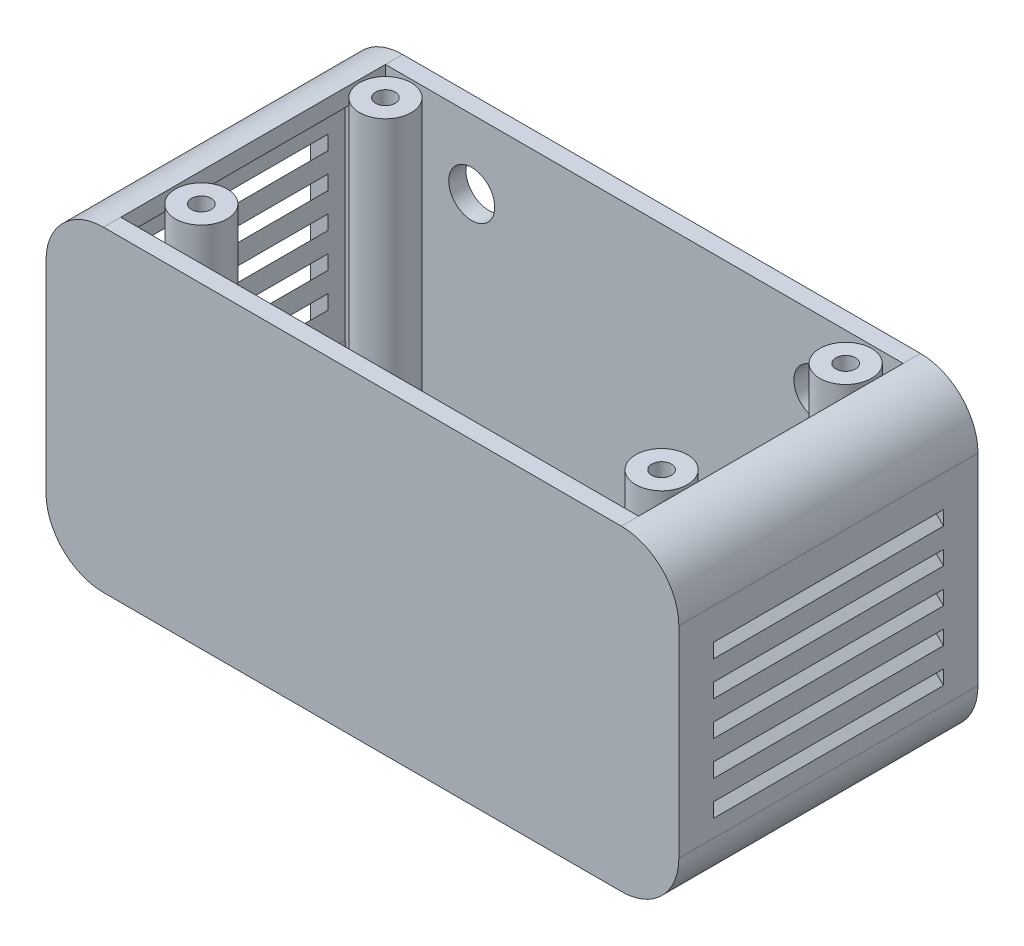
from build123d import *

# Parameters (mm, degrees)
BOSS_EXTRUDE1_DEPTH     = 52
SHELL1_START            = 3
SHELL1_DEPTH            = 46
SKETCH2_R               = 4.5
BOSS_EXTRUDE2_DEPTH     = 52
SKETCH3_R               = 3.25
CUT_EXTRUDE1_DEPTH      = 49
SKETCH4_R               = 1.7
CUT_EXTRUDE2_DEPTH      = 91.166512631
CUT_EXTRUDE3_DEPTH      = 20
CUT_EXTRUDE3_DEPTH_BACK = 20
CUT_EXTRUDE4_DEPTH      = 3.5
SKETCH7_R               = 4
CUT_EXTRUDE5_DEPTH      = 3.5
SKETCH8_W               = 6
SKETCH8_H               = 20
BOSS_EXTRUDE3_DEPTH     = 8
SKETCH9_W               = 1.9
SKETCH9_H               = 16.6
CUT_EXTRUDE6_DEPTH      = 6
SKETCH10_R              = 5
CUT_EXTRUDE7_DEPTH      = 3.5


# Read off the part's stored shape, not the designer's step: Shell1
with BuildPart() as part:
    # Sketch1 → Boss-Extrude1 (new body)
    with BuildSketch(Plane.XY):
        with BuildLine():
            Line((-45, -55), (45, -55))
            ThreePointArc((45, -55), (52.071067812, -52.071067812), (55, -45))
            Line((55, -45), (55, -10))
            ThreePointArc((55, -10), (52.071067812, -2.928932188), (45, 0))
            Line((45, 0), (-45, 0))
            ThreePointArc((-45, 0), (-52.071067812, -2.928932188), (-55, -10))
            Line((-55, -10), (-55, -45))
            ThreePointArc((-55, -45), (-52.071067812, -52.071067812), (-45, -55))
        make_face()
    extrude(amount=BOSS_EXTRUDE1_DEPTH)

    # Shell1 outline → Shell1 (cut)
    with BuildSketch(Plane.XY.offset(SHELL1_START)):
        with BuildLine():
            Line((45, -3), (45, 0))
            Line((45, 0), (-45, 0))
            Line((-45, 0), (-45, -3))
            ThreePointArc((-45, -3), (-49.949747468, -5.050252532), (-52, -10))
            Line((-52, -10), (-52, -45))
            ThreePointArc((-52, -45), (-49.949747468, -49.949747468), (-45, -52))
            Line((-45, -52), (45, -52))
            ThreePointArc((45, -52), (49.949747468, -49.949747468), (52, -45))
            Line((52, -45), (52, -10))
            ThreePointArc((52, -10), (49.949747468, -5.050252532), (45, -3))
        make_face()
    extrude(amount=SHELL1_DEPTH, mode=Mode.SUBTRACT)

    # Sketch2 → Boss-Extrude2 (add)
    with BuildSketch(Plane(origin=(0, 0, 0), x_dir=(1, 0, 0), z_dir=(0, 1, 0))):
        with Locations(Location((-40, -8, 0), (0, 0, 270))):
            Circle(SKETCH2_R)
        with Locations(Location((40, -8, 0), (0, 0, 270))):
            Circle(SKETCH2_R)
        with Locations(Location((-40, -40, 0), (0, 0, 270))):
            Circle(SKETCH2_R)
        with Locations(Location((40, -40, 0), (0, 0, 270))):
            Circle(SKETCH2_R)
    extrude(amount=-BOSS_EXTRUDE2_DEPTH)

    # Sketch3 → Cut-Extrude1 (cut)
    with BuildSketch(Plane.XZ.offset(55)):
        with Locations(Location((-40, 8, 0), (0, 0, 270))):
            Circle(SKETCH3_R)
        with Locations(Location((40, 8, 0), (0, 0, 270))):
            Circle(SKETCH3_R)
        with Locations(Location((-40, 40, 0), (0, 0, 270))):
            Circle(SKETCH3_R)
        with Locations(Location((40, 40, 0), (0, 0, 270))):
            Circle(SKETCH3_R)
    extrude(amount=-CUT_EXTRUDE1_DEPTH, mode=Mode.SUBTRACT)

    # Sketch4 → Cut-Extrude2 (cut, through all)
    with BuildSketch(Plane.XZ.offset(6)):
        with Locations(Location((-40, 8, 0), (0, 0, 270))):
            Circle(SKETCH4_R)
        with Locations(Location((40, 8, 0), (0, 0, 270))):
            Circle(SKETCH4_R)
        with Locations(Location((-40, 40, 0), (0, 0, 270))):
            Circle(SKETCH4_R)
        with Locations(Location((40, 40, 0), (0, 0, 270))):
            Circle(SKETCH4_R)
    extrude(amount=-CUT_EXTRUDE2_DEPTH, mode=Mode.SUBTRACT)

    # Sketch5 → Cut-Extrude3 (cut, two sides: drawn at the far end of the back side and taken through both)
    with BuildSketch(Plane.XY.offset(26).offset(-CUT_EXTRUDE3_DEPTH_BACK)):
        Polygon((-51, -14), (-51, -11.5), (-55.5, -16), (-55.5, -18.5), align=None)
        Polygon((51, -14), (51, -11.5), (55.5, -16), (55.5, -18.5), align=None)
        Polygon((-51, -20), (-51, -17.5), (-55.5, -22), (-55.5, -24.5), align=None)
        Polygon((51, -20), (51, -17.5), (55.5, -22), (55.5, -24.5), align=None)
        Polygon((-51, -26), (-51, -23.5), (-55.5, -28), (-55.5, -30.5), align=None)
        Polygon((51, -26), (51, -23.5), (55.5, -28), (55.5, -30.5), align=None)
        Polygon((-51, -32), (-51, -29.5), (-55.5, -34), (-55.5, -36.5), align=None)
        Polygon((51, -32), (51, -29.5), (55.5, -34), (55.5, -36.5), align=None)
        Polygon((-51, -38), (-51, -35.5), (-55.5, -40), (-55.5, -42.5), align=None)
        Polygon((51, -38), (51, -35.5), (55.5, -40), (55.5, -42.5), align=None)
    extrude(amount=CUT_EXTRUDE3_DEPTH + CUT_EXTRUDE3_DEPTH_BACK, mode=Mode.SUBTRACT)

    # Sketch6 → Cut-Extrude4 (cut)
    with BuildSketch(Plane.XZ.offset(55)):
        with BuildLine():
            Line((-34.5, 12), (-34.5, 40))
            ThreePointArc((-34.5, 40), (-33, 41.5), (-31.5, 40))
            Line((-31.5, 40), (-31.5, 12))
            ThreePointArc((-31.5, 12), (-33, 10.5), (-34.5, 12))
        make_face()
        with BuildLine():
            Line((-28.5, 12), (-28.5, 40))
            ThreePointArc((-28.5, 40), (-27, 41.5), (-25.5, 40))
            Line((-25.5, 40), (-25.5, 12))
            ThreePointArc((-25.5, 12), (-27, 10.5), (-28.5, 12))
        make_face()
        with BuildLine():
            Line((-22.5, 12), (-22.5, 40))
            ThreePointArc((-22.5, 40), (-21, 41.5), (-19.5, 40))
            Line((-19.5, 40), (-19.5, 12))
            ThreePointArc((-19.5, 12), (-21, 10.5), (-22.5, 12))
        make_face()
        with BuildLine():
            Line((-16.5, 12), (-16.5, 40))
            ThreePointArc((-16.5, 40), (-15, 41.5), (-13.5, 40))
            Line((-13.5, 40), (-13.5, 12))
            ThreePointArc((-13.5, 12), (-15, 10.5), (-16.5, 12))
        make_face()
        with BuildLine():
            Line((-10.5, 12), (-10.5, 40))
            ThreePointArc((-10.5, 40), (-9, 41.5), (-7.5, 40))
            Line((-7.5, 40), (-7.5, 12))
            ThreePointArc((-7.5, 12), (-9, 10.5), (-10.5, 12))
        make_face()
        with BuildLine():
            Line((-4.5, 12), (-4.5, 40))
            ThreePointArc((-4.5, 40), (-3, 41.5), (-1.5, 40))
            Line((-1.5, 40), (-1.5, 12))
            ThreePointArc((-1.5, 12), (-3, 10.5), (-4.5, 12))
        make_face()
        with BuildLine():
            Line((1.5, 12), (1.5, 40))
            ThreePointArc((1.5, 40), (3, 41.5), (4.5, 40))
            Line((4.5, 40), (4.5, 12))
            ThreePointArc((4.5, 12), (3, 10.5), (1.5, 12))
        make_face()
        with BuildLine():
            Line((7.5, 12), (7.5, 40))
            ThreePointArc((7.5, 40), (9, 41.5), (10.5, 40))
            Line((10.5, 40), (10.5, 12))
            ThreePointArc((10.5, 12), (9, 10.5), (7.5, 12))
        make_face()
        with BuildLine():
            Line((31.5, 12), (31.5, 40))
            ThreePointArc((31.5, 40), (33, 41.5), (34.5, 40))
            Line((34.5, 40), (34.5, 12))
            ThreePointArc((34.5, 12), (33, 10.5), (31.5, 12))
        make_face()
    extrude(amount=-CUT_EXTRUDE4_DEPTH, mode=Mode.SUBTRACT)

    # Sketch7 → Cut-Extrude5 (cut)
    with BuildSketch(Plane(origin=(0, 0, 0), x_dir=(-1, 0, 0), z_dir=(0, 0, -1))):
        with Locations((30, -12)):
            Circle(SKETCH7_R)
        with Locations((-30, -12)):
            Circle(SKETCH7_R)
    extrude(amount=-CUT_EXTRUDE5_DEPTH, mode=Mode.SUBTRACT)

    # Sketch8 → Boss-Extrude3 (add)
    with BuildSketch(Plane(origin=(0, -52, 0), x_dir=(1, 0, 0), z_dir=(0, 1, 0))):
        with Locations((-44, -26)):
            Rectangle(SKETCH8_W, SKETCH8_H)
    extrude(amount=BOSS_EXTRUDE3_DEPTH)

    # Sketch9 → Cut-Extrude6 (cut)
    with BuildSketch(Plane(origin=(0, -44, 0), x_dir=(1, 0, 0), z_dir=(0, 1, 0))):
        with Locations((-44, -26)):
            Rectangle(SKETCH9_W, SKETCH9_H)
    extrude(amount=-CUT_EXTRUDE6_DEPTH, mode=Mode.SUBTRACT)

    # Sketch10 → Cut-Extrude7 (cut)
    with BuildSketch(Plane.XZ.offset(55)):
        with Locations(Location((20, 26, 0), (0, 0, 270))):
            Circle(SKETCH10_R)
    extrude(amount=-CUT_EXTRUDE7_DEPTH, mode=Mode.SUBTRACT)


solid = part.part
